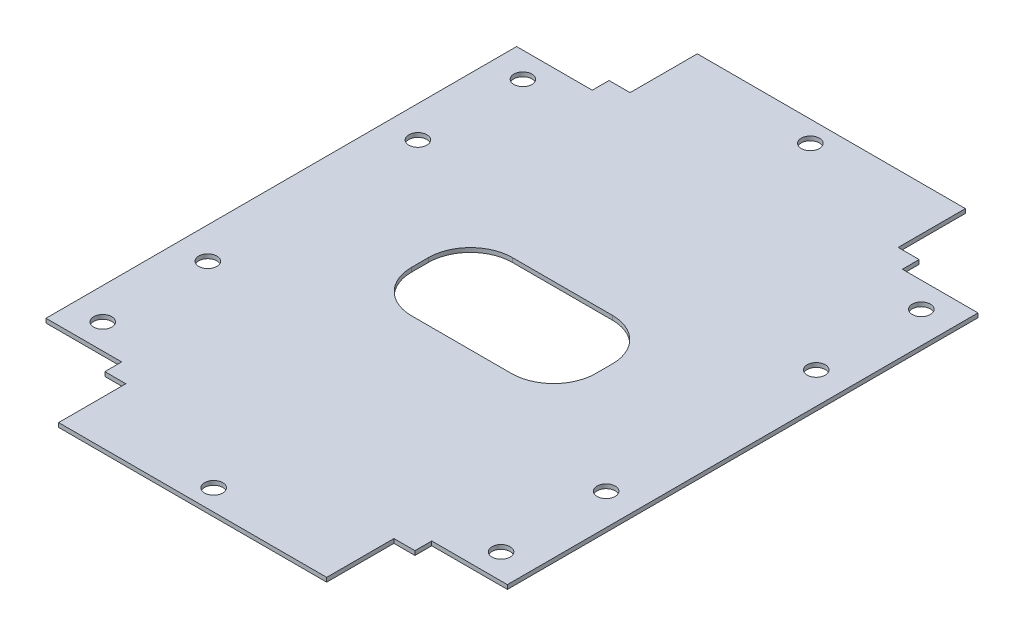
from build123d import *

# Parameters (mm, degrees)
SKETCH1_R           = 2.15
SKETCH1_W           = 43.8
SKETCH1_H           = 24
BOSS_EXTRUDE1_DEPTH = 1
FILLET2_R           = 10


with BuildPart() as part:
    # Sketch1 → Boss-Extrude1 (new body)
    with BuildSketch(Plane(origin=(0, 0, 0), x_dir=(1, 0, 0), z_dir=(0, 1, 0))):
        Polygon((-54.9, -56), (-36.9, -56), (-36.9, -60), (-31.9, -60), (-31.9, -76), (31.9, -76), (31.9, -60), (36.9, -60), (36.9, -56), (54.9, -56), (54.9, 56), (36.9, 56), (36.9, 60), (31.9, 60), (31.9, 76), (-31.9, 76), (-31.9, 60), (-36.9, 60), (-36.9, 56), (-54.9, 56), align=None)
        with Locations((-47.4, 25)):
            Circle(SKETCH1_R, mode=Mode.SUBTRACT)
        with Locations((47.4, 25)):
            Circle(SKETCH1_R, mode=Mode.SUBTRACT)
        with Locations((-47.4, -25)):
            Circle(SKETCH1_R, mode=Mode.SUBTRACT)
        with Locations((47.4, -25)):
            Circle(SKETCH1_R, mode=Mode.SUBTRACT)
        with Locations((-47.4, -50)):
            Circle(SKETCH1_R, mode=Mode.SUBTRACT)
        with Locations((47.4, -50)):
            Circle(SKETCH1_R, mode=Mode.SUBTRACT)
        with Locations((47.4, 50)):
            Circle(SKETCH1_R, mode=Mode.SUBTRACT)
        with Locations((-47.4, 50)):
            Circle(SKETCH1_R, mode=Mode.SUBTRACT)
        with Locations((0, 71)):
            Circle(SKETCH1_R, mode=Mode.SUBTRACT)
        with Locations((0, -71)):
            Circle(SKETCH1_R, mode=Mode.SUBTRACT)
        Rectangle(SKETCH1_W, SKETCH1_H, mode=Mode.SUBTRACT)
    extrude(amount=BOSS_EXTRUDE1_DEPTH)

    # Fillet2
    fillet2_edges = [part.edges().sort_by_distance(p)[0] for p in [
        (21.9, 0.5, -12),
        (-21.9, 0.5, -12),
        (21.9, 0.5, 12),
        (-21.9, 0.5, 12),
    ]]
    fillet(fillet2_edges, radius=FILLET2_R)


solid = part.part
